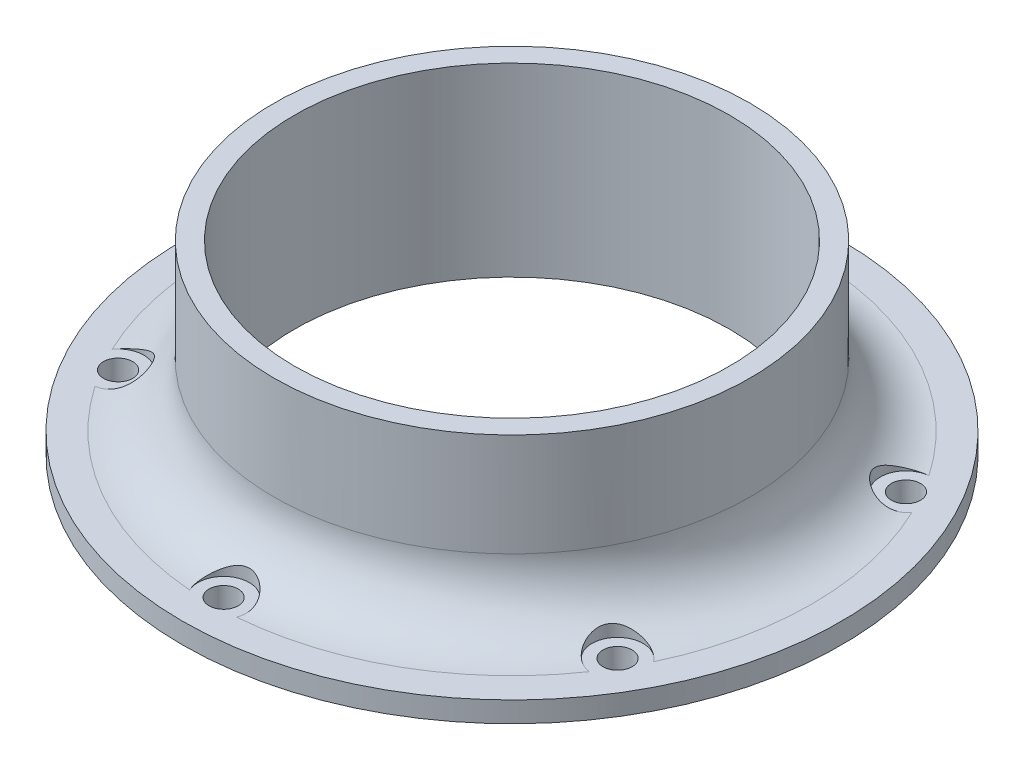
from build123d import *

# Parameters (mm, degrees)
SKETCH1_R           = 36.703
SKETCH1_R_2         = 33.528
BOSS_EXTRUDE1_DEPTH = 25.4
BOSS_EXTRUDE2_START = 3.175
SKETCH2_R           = 50.8
SKETCH2_R_2         = 33.528
BOSS_EXTRUDE2_DEPTH = 3.175
FILLET1_R           = 9.525
SKETCH5_W           = 2.2479
SKETCH5_H           = 3.175
CIRPATTERN1_COUNT   = 6
SKETCH6_R           = 3.9624
CUT_EXTRUDE1_DEPTH  = 52.07
CIRPATTERN2_COUNT   = 6


with BuildPart() as part:
    # Sketch1 → Boss-Extrude1 (new body)
    with BuildSketch(Plane(origin=(0, 0, 0), x_dir=(1, 0, 0), z_dir=(0, 1, 0))):
        Circle(SKETCH1_R)
        Circle(SKETCH1_R_2, mode=Mode.SUBTRACT)
    extrude(amount=BOSS_EXTRUDE1_DEPTH)

    # Sketch2 → Boss-Extrude2 (add)
    with BuildSketch(Plane.XZ.offset(BOSS_EXTRUDE2_START)):
        Circle(SKETCH2_R)
        Circle(SKETCH2_R_2, mode=Mode.SUBTRACT)
    extrude(amount=-BOSS_EXTRUDE2_DEPTH)

    # Fillet1
    fillet1_edges = [part.edges().sort_by_distance(p)[0] for p in [
        (-36.703, 0, 0),
    ]]
    fillet(fillet1_edges, radius=FILLET1_R)

    # Sketch5 → #8 Clearance Hole1 (revolve, cut)
    with BuildSketch(Plane(origin=(0, 0, -44.45), x_dir=(0, 0, 1), z_dir=(1, 0, 0))):
        with Locations((1.12395, 1.5875)):
            Rectangle(SKETCH5_W, SKETCH5_H)
    f_8_clearance_hole1 = revolve(axis=Axis((0, 6.35, -44.45), (0, -1, 0)), mode=Mode.SUBTRACT)

    # CirPattern1: #8 Clearance Hole1 ×6 about axis
    cirpattern1_axis = Axis((0, 25.4, 0), (0, -1, 0))
    for i in range(1, CIRPATTERN1_COUNT):
        add(f_8_clearance_hole1.rotate(cirpattern1_axis, i * 360 / CIRPATTERN1_COUNT), mode=Mode.SUBTRACT)

    # Sketch6 → Cut-Extrude1 (cut)
    with BuildSketch(Plane(origin=(0, 0, 0), x_dir=(1, 0, 0), z_dir=(0, 1, 0))):
        with Locations((0, 44.45)):
            Circle(SKETCH6_R)
    cut_extrude1 = extrude(amount=CUT_EXTRUDE1_DEPTH, mode=Mode.SUBTRACT)

    # CirPattern2: Cut-Extrude1 ×6 about axis
    cirpattern2_axis = Axis((0, -3.175, 0), (0, 1, 0))
    for i in range(1, CIRPATTERN2_COUNT):
        add(cut_extrude1.rotate(cirpattern2_axis, i * 360 / CIRPATTERN2_COUNT), mode=Mode.SUBTRACT)


solid = part.part
